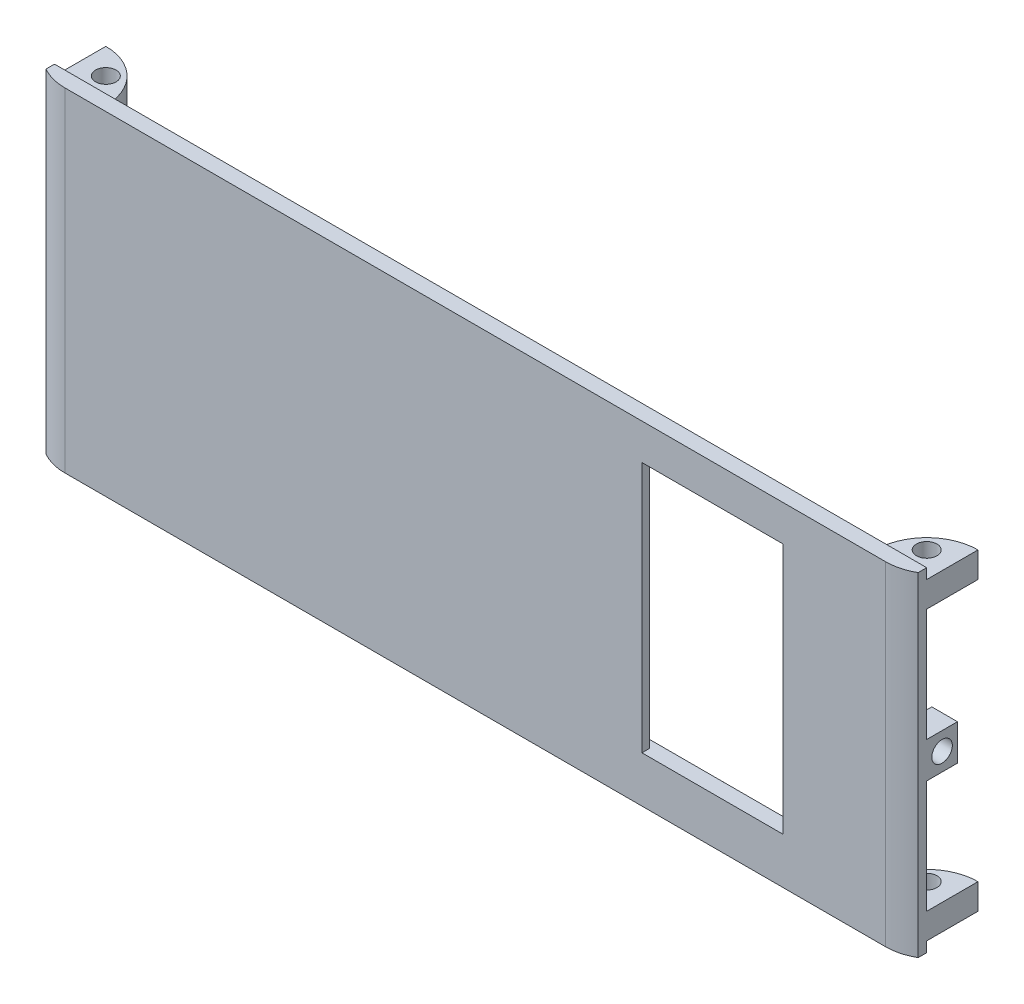
from build123d import *

# Parameters (mm, degrees)
SKIZZE1_W                                  = 180
SKIZZE1_H                                  = 65
AUFSATZ_LINEAR_AUSTRAGEN1_DEPTH            = 3
SKIZZE3_W                                  = 5
SKIZZE3_H                                  = 7
AUFSATZ_LINEAR_AUSTRAGEN2_DEPTH            = 6
F_4_0_4_DURCHMESSER_BOHRUNG1_D             = 4
SCHNITT_LINEAR_AUSTRAGEN1_DEPTH            = 112.180034179
SKIZZE7_W                                  = 27.5
SKIZZE7_H                                  = 49
SCHNITT_LINEAR_AUSTRAGEN2_DEPTH            = 92.445338864
SKIZZE8_W                                  = 10
SKIZZE8_H                                  = 5
AUFSATZ_LINEAR_AUSTRAGEN3_DEPTH            = 10
SPIEGELN1_AT_THE_SECOND_PLANE_COPY_1_SKE_W = 10
SPIEGELN1_AT_THE_SECOND_PLANE_COPY_1_SKE_H = 5
SPIEGELN1_AT_THE_SECOND_PLANE_COPY_1_DEPTH = 10
VERRUNDUNG1_R                              = 10
F_4_0_4_DURCHMESSER_BOHRUNG2_D             = 4
F_4_0_4_DURCHMESSER_BOHRUNG2_DEPTH         = 5
F_4_0_4_DURCHMESSER_BOHRUNG3_D             = 4
F_4_0_4_DURCHMESSER_BOHRUNG3_DEPTH         = 5
SKIZZE13_W                                 = 30.5
SKIZZE13_H                                 = 49
SCHNITT_LINEAR_AUSTRAGEN4_DEPTH            = 1.5


with BuildPart() as part:
    # Skizze1 → Aufsatz-Linear austragen1 (new body)
    with BuildSketch(Plane.XY):
        Rectangle(SKIZZE1_W, SKIZZE1_H)
    extrude(amount=AUFSATZ_LINEAR_AUSTRAGEN1_DEPTH)

    # Skizze3 → Aufsatz-Linear austragen2 (add)
    with BuildSketch(Plane(origin=(0, 0, 0), x_dir=(-1, 0, 0), z_dir=(0, 0, -1))):
        with Locations((-82.5, 0)):
            Rectangle(SKIZZE3_W, SKIZZE3_H)
        with Locations((82.5, 0)):
            Rectangle(SKIZZE3_W, SKIZZE3_H)
    extrude(amount=AUFSATZ_LINEAR_AUSTRAGEN2_DEPTH)

    # Ø4.0 (4) Durchmesser Bohrung1 (through all)
    with Locations(Plane.ZY.offset(85)):
        with Locations((-3, 0)):
            Hole(F_4_0_4_DURCHMESSER_BOHRUNG1_D / 2)

    # Skizze6 → Schnitt-Linear austragen1 (cut, through all)
    with BuildSketch(Plane(origin=(0, 32.5, 0), x_dir=(1, 0, 0), z_dir=(0, 1, 0))):
        with BuildLine():
            Line((-80, -3), (-90, -3))
            Line((-90, -3), (-90, 0))
            Line((-90, 0), (-85, 0))
            Line((-85, 0), (-85, -1.660254038))
            ThreePointArc((-85, -1.660254038), (-82.588190451, -2.659258263), (-80, -3))
        make_face()
        with BuildLine():
            Line((80, -3), (90, -3))
            Line((90, -3), (90, 0))
            Line((90, 0), (85, 0))
            Line((85, 0), (85, -1.660254038))
            ThreePointArc((85, -1.660254038), (82.588190451, -2.659258263), (80, -3))
        make_face()
    extrude(amount=-SCHNITT_LINEAR_AUSTRAGEN1_DEPTH, mode=Mode.SUBTRACT)

    # Skizze7 → Schnitt-Linear austragen2 (cut, through all)
    with BuildSketch(Plane.XY.offset(3)):
        with Locations((46.25, 1)):
            Rectangle(SKIZZE7_W, SKIZZE7_H)
    extrude(amount=-SCHNITT_LINEAR_AUSTRAGEN2_DEPTH, mode=Mode.SUBTRACT)

    # Skizze8 → Aufsatz-Linear austragen3 (add)
    with BuildSketch(Plane(origin=(0, 0, 0), x_dir=(-1, 0, 0), z_dir=(0, 0, -1))):
        with Locations((-80, 28)):
            Rectangle(SKIZZE8_W, SKIZZE8_H)
    aufsatz_linear_austragen3 = extrude(amount=AUFSATZ_LINEAR_AUSTRAGEN3_DEPTH)

    # Spiegeln1: Aufsatz-Linear austragen3 across plane
    add(aufsatz_linear_austragen3.mirror(Plane(origin=(0, 0, 0), x_dir=(0, 0, 1), z_dir=(1, 0, 0))))

    # Spiegeln1 at the second plane: Aufsatz-Linear austragen3 across plane
    add(aufsatz_linear_austragen3.mirror(Plane.ZX))

    # Spiegeln1 at the second plane copy 1 ske → Spiegeln1 at the second plane copy 1 (add)
    with BuildSketch(Plane(origin=(0, 0, 0), x_dir=(1, 0, 0), z_dir=(0, 0, -1))):
        with Locations((-80, 28)):
            Rectangle(SPIEGELN1_AT_THE_SECOND_PLANE_COPY_1_SKE_W, SPIEGELN1_AT_THE_SECOND_PLANE_COPY_1_SKE_H)
    extrude(amount=SPIEGELN1_AT_THE_SECOND_PLANE_COPY_1_DEPTH)

    # Verrundung1
    verrundung1_edges = [part.edges().sort_by_distance(p)[0] for p in [
        (75, 28, -10),
        (75, -28, -10),
        (-75, 28, -10),
        (-75, -28, -10),
    ]]
    fillet(verrundung1_edges, radius=VERRUNDUNG1_R - 0.0001)  # a hair under: the kernel refuses the full size

    # Ø4.0 (4) Durchmesser Bohrung2
    with Locations(Plane(origin=(0, 30.5, 0), x_dir=(1, 0, 0), z_dir=(0, 1, 0))):
        with Locations((-80, 5), (80, 5)):
            Hole(F_4_0_4_DURCHMESSER_BOHRUNG2_D / 2, depth=F_4_0_4_DURCHMESSER_BOHRUNG2_DEPTH)

    # Ø4.0 (4) Durchmesser Bohrung3
    with Locations(Plane(origin=(0, -30.5, 0), x_dir=(-1, 0, 0), z_dir=(0, -1, 0))):
        with Locations((-80, 5), (80, 5)):
            Hole(F_4_0_4_DURCHMESSER_BOHRUNG3_D / 2, depth=F_4_0_4_DURCHMESSER_BOHRUNG3_DEPTH)

    # Skizze13 → Schnitt-Linear austragen4 (cut)
    with BuildSketch(Plane(origin=(0, 0, 0), x_dir=(-1, 0, 0), z_dir=(0, 0, -1))):
        with Locations((-46.25, 1)):
            Rectangle(SKIZZE13_W, SKIZZE13_H)
    extrude(amount=-SCHNITT_LINEAR_AUSTRAGEN4_DEPTH, mode=Mode.SUBTRACT)


solid = part.part
